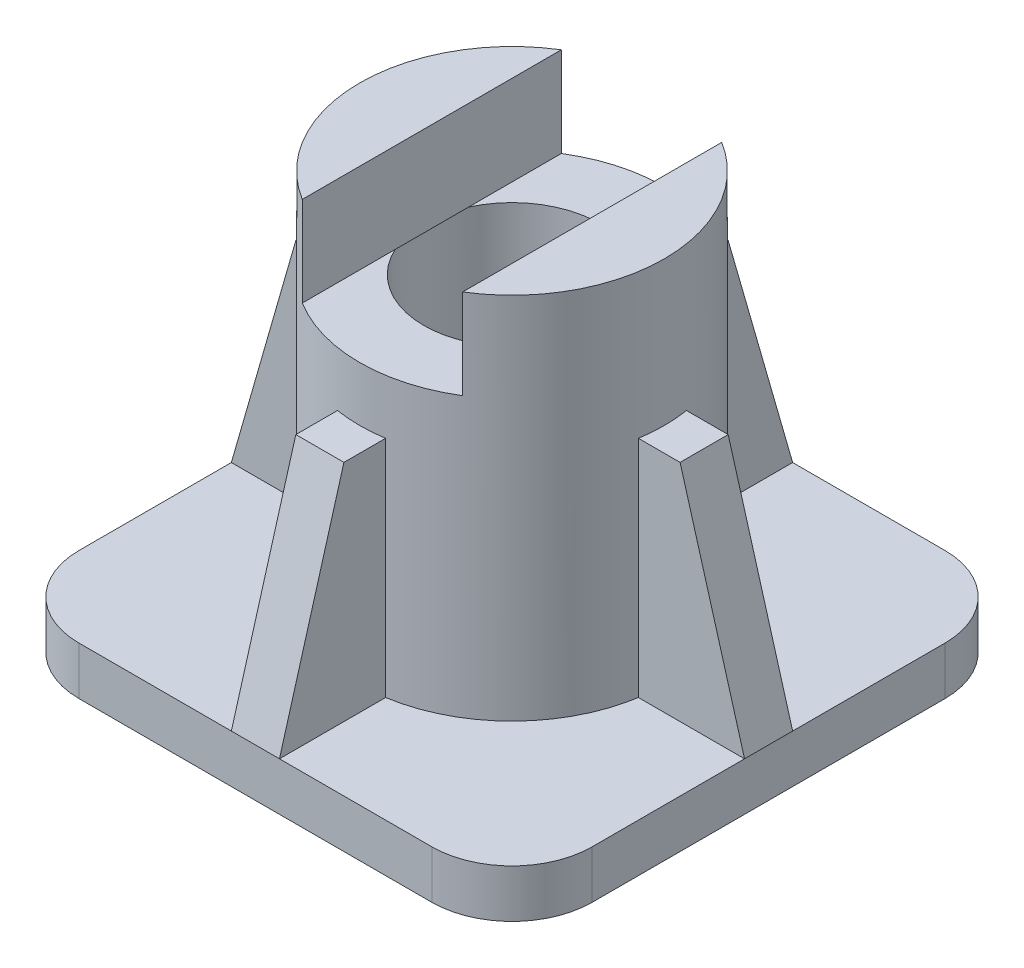
from build123d import *

# Parameters (mm, degrees)
SKETCH1_W           = 160
SKETCH1_H           = 160
BOSS_EXTRUDE1_DEPTH = 15
SKETCH2_R           = 47.5
BOSS_EXTRUDE2_DEPTH = 115
BOSS_EXTRUDE3_DEPTH = 70
CUT_EXTRUDE1_DEPTH  = 15
CIRPATTERN1_START   = -87.5
CIRPATTERN1_DEPTH   = 15
CIRPATTERN1_START_2 = 72.5
CIRPATTERN1_2_DEPTH = 15
SKETCH4_W           = 50
SKETCH4_H           = 28
CUT_EXTRUDE2_DEPTH  = 261.959767014
SKETCH5_W           = 27.5
SKETCH5_H           = 102.001
FILLET1_R           = 25


# Read off the part's stored shape, not the designer's step: CirPattern1
with BuildPart() as part:
    # Sketch1 → Boss-Extrude1 (new body)
    with BuildSketch(Plane(origin=(0, 0, 0), x_dir=(1, 0, 0), z_dir=(0, 1, 0))):
        with Locations((80, 80)):
            Rectangle(SKETCH1_W, SKETCH1_H)
    extrude(amount=BOSS_EXTRUDE1_DEPTH)

    # Sketch2 → Boss-Extrude2 (add)
    with BuildSketch(Plane(origin=(0, 15, 0), x_dir=(1, 0, 0), z_dir=(0, 1, 0))):
        with Locations(Location((80, 80, 0), (0, 0, 270))):
            Circle(SKETCH2_R)
    extrude(amount=BOSS_EXTRUDE2_DEPTH)

    # CirPattern1 outline → CirPattern1 (add)
    with BuildSketch(Plane.XY.offset(CIRPATTERN1_START)):
        Polygon((82, 85), (20.095842402, 85), (0, 15), (82, 15), align=None)
    extrude(amount=CIRPATTERN1_DEPTH)

    # CirPattern1 2 outline → CirPattern1 2 (add)
    with BuildSketch(Plane.YZ.offset(CIRPATTERN1_START_2)):
        Polygon((15, -160), (85, -139.904157598), (85, -20.095842402), (15, 0), align=None)
    extrude(amount=CIRPATTERN1_2_DEPTH)

    # Sketch4 → Cut-Extrude2 (cut, through all)
    with BuildSketch(Plane.XY):
        with Locations((80, 116)):
            Rectangle(SKETCH4_W, SKETCH4_H)
    extrude(amount=-CUT_EXTRUDE2_DEPTH, mode=Mode.SUBTRACT)

    # Sketch5 → Ø12.0 (55) Diameter Hole1 (revolve, cut)
    with BuildSketch(Plane(origin=(80, 102, -80), x_dir=(0, 0, 1), z_dir=(1, 0, 0))):
        with Locations((13.75, 51.0005)):
            Rectangle(SKETCH5_W, SKETCH5_H)
    revolve(axis=Axis((80, 108.35, -80), (0, -1, 0)), mode=Mode.SUBTRACT)

    # Fillet1
    fillet1_edges = [part.edges().sort_by_distance(p)[0] for p in [
        (0, 7.5, 0),
        (0, 7.5, -160),
        (160, 7.5, -160),
        (160, 7.5, 0),
    ]]
    fillet(fillet1_edges, radius=FILLET1_R)


with BuildPart() as body_2:
    # Sketch2<5> → Boss-Extrude3 (new body)
    with BuildSketch(Plane(origin=(0, 15, 0), x_dir=(1, 0, 0), z_dir=(0, 1, 0))):
        with BuildLine():
            Line((126.904157598, 72.5), (160, 72.5))
            Line((160, 72.5), (160, 87.5))
            Line((160, 87.5), (126.904157598, 87.5))
            ThreePointArc((126.904157598, 87.5), (127.350805093, 83.761815658), (127.5, 80))
            ThreePointArc((127.5, 80), (127.350805093, 76.238184342), (126.904157598, 72.5))
        make_face()
    extrude(amount=BOSS_EXTRUDE3_DEPTH)

    # Sketch3 → Cut-Extrude1 (cut)
    with BuildSketch(Plane.XY.offset(-72.5)):
        Polygon((139.904157598, 85), (160, 15), (160, 85), align=None)
    extrude(amount=-CUT_EXTRUDE1_DEPTH, mode=Mode.SUBTRACT)


solid = Compound([part.part, body_2.part])
